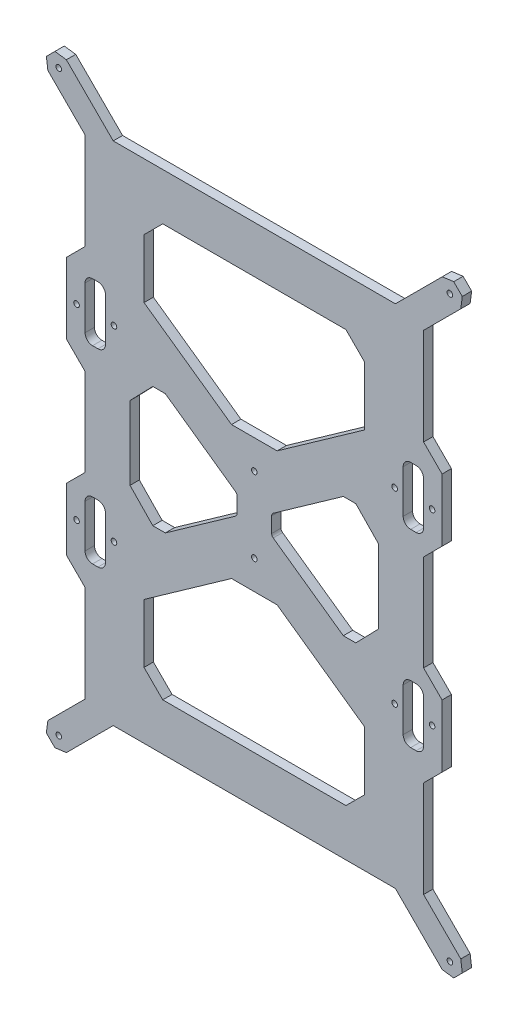
from build123d import *

# Parameters (mm, degrees)
SCHIZZO1_R                   = 1.5
ESTRUSIONE_ESTRUSIONE1_DEPTH = 5


with BuildPart() as part:
    # Schizzo1 → Estrusione-Estrusione1 (new body)
    with BuildSketch(Plane.XY):
        Polygon((-111.130864092, 156.55753287), (-106.55753287, 161.130864092), (-100.431262317, 160.330757253), (-75.393295673, 135.29279061), (75.393295673, 135.29279061), (100.431262317, 160.330757253), (106.55753287, 161.130864092), (111.130864092, 156.55753287), (110.330757253, 150.431262317), (90.448609444, 130.549114507), (90.448609444, 78.874114811), (100.330757253, 68.991967001), (100.330757253, 35.563826068), (90.448609444, 25.681678258), (90.448609444, -25.681678258), (100.330757253, -35.563826068), (100.330757253, -68.991967001), (90.448609444, -78.874114811), (90.448609444, -130.549114507), (110.330757253, -150.431262317), (111.130864092, -156.55753287), (106.55753287, -161.130864092), (100.431262317, -160.330757253), (75.393295673, -135.29279061), (-75.393295673, -135.29279061), (-100.431262317, -160.330757253), (-106.55753287, -161.130864092), (-111.130864092, -156.55753287), (-110.330757253, -150.431262317), (-90.448609444, -130.549114507), (-90.448609444, -78.874114811), (-100.330757253, -68.991967001), (-100.330757253, -35.563826068), (-90.448609444, -25.681678258), (-90.448609444, 21.125885189), (-100.330757253, 31.008032999), (-100.330757253, 68.991967001), (-90.448609444, 78.874114811), (-90.448609444, 130.549114507), (-110.330757253, 150.431262317), align=None)
        with Locations((-95, 50)):
            Circle(SCHIZZO1_R, mode=Mode.SUBTRACT)
        with Locations((-75, 50)):
            Circle(SCHIZZO1_R, mode=Mode.SUBTRACT)
        with Locations((-104.5, 154.5)):
            Circle(SCHIZZO1_R, mode=Mode.SUBTRACT)
        with Locations((104.5, 154.5)):
            Circle(SCHIZZO1_R, mode=Mode.SUBTRACT)
        with Locations((75, 50)):
            Circle(SCHIZZO1_R, mode=Mode.SUBTRACT)
        with Locations((95, 50)):
            Circle(SCHIZZO1_R, mode=Mode.SUBTRACT)
        with Locations((0, 20.131279802)):
            Circle(SCHIZZO1_R, mode=Mode.SUBTRACT)
        with Locations((0, -20.131279802)):
            Circle(SCHIZZO1_R, mode=Mode.SUBTRACT)
        with Locations((95, -50)):
            Circle(SCHIZZO1_R, mode=Mode.SUBTRACT)
        with Locations((75, -50)):
            Circle(SCHIZZO1_R, mode=Mode.SUBTRACT)
        with Locations((104.5, -154.5)):
            Circle(SCHIZZO1_R, mode=Mode.SUBTRACT)
        with Locations((-104.5, -154.5)):
            Circle(SCHIZZO1_R, mode=Mode.SUBTRACT)
        with Locations((-75, -50)):
            Circle(SCHIZZO1_R, mode=Mode.SUBTRACT)
        with Locations((-95, -50)):
            Circle(SCHIZZO1_R, mode=Mode.SUBTRACT)
        with BuildLine():
            Line((-66.435665908, 19.62934529), (-66.435665908, -19.62934529))
            Line((-66.435665908, -19.62934529), (-54.243131725, -32.22180516))
            Line((-54.243131725, -32.22180516), (-47.563810674, -32.22180516))
            Line((-47.563810674, -32.22180516), (-10.101900389, -5.729003291))
            ThreePointArc((-10.101900389, -5.729003291), (-9.48052072, -5.015427148), (-9.256694819, -4.096076524))
            Line((-9.256694819, -4.096076524), (-9.256694819, 4.096076524))
            ThreePointArc((-9.256694819, 4.096076524), (-9.48052072, 5.015427148), (-10.101900389, 5.729003291))
            Line((-10.101900389, 5.729003291), (-47.563810674, 32.22180516))
            Line((-47.563810674, 32.22180516), (-54.243131725, 32.22180516))
            Line((-54.243131725, 32.22180516), (-66.435665908, 19.62934529))
        make_face(mode=Mode.SUBTRACT)
        Polygon((-58.942185062, 100.139969228), (-58.942185062, 68.700211283), (-12.181822312, 35.631608635), (12.181822312, 35.631608635), (58.942185062, 68.700211283), (58.942185062, 100.139969228), (48.942185062, 110.139969228), (-48.942185062, 110.139969228), align=None, mode=Mode.SUBTRACT)
        with BuildLine():
            Line((-86.448609444, 35.007036896), (-83.551390556, 35.007036896))
            ThreePointArc((-83.551390556, 35.007036896), (-80.722963432, 36.178609771), (-79.551390556, 39.007036896))
            Line((-79.551390556, 39.007036896), (-79.551390556, 62.007036896))
            ThreePointArc((-79.551390556, 62.007036896), (-80.722963432, 64.835464021), (-83.551390556, 66.007036896))
            Line((-83.551390556, 66.007036896), (-86.448609444, 66.007036896))
            ThreePointArc((-86.448609444, 66.007036896), (-89.277036568, 64.835464021), (-90.448609444, 62.007036896))
            Line((-90.448609444, 62.007036896), (-90.448609444, 39.007036896))
            ThreePointArc((-90.448609444, 39.007036896), (-89.277036568, 36.178609771), (-86.448609444, 35.007036896))
        make_face(mode=Mode.SUBTRACT)
        with BuildLine():
            Line((86.448609444, 66.007036896), (83.551390556, 66.007036896))
            ThreePointArc((83.551390556, 66.007036896), (80.722963432, 64.835464021), (79.551390556, 62.007036896))
            Line((79.551390556, 62.007036896), (79.551390556, 39.007036896))
            ThreePointArc((79.551390556, 39.007036896), (80.722963432, 36.178609771), (83.551390556, 35.007036896))
            Line((83.551390556, 35.007036896), (86.448609444, 35.007036896))
            ThreePointArc((86.448609444, 35.007036896), (89.277036568, 36.178609771), (90.448609444, 39.007036896))
            Line((90.448609444, 39.007036896), (90.448609444, 62.007036896))
            ThreePointArc((90.448609444, 62.007036896), (89.277036568, 64.835464021), (86.448609444, 66.007036896))
        make_face(mode=Mode.SUBTRACT)
        with BuildLine():
            Line((47.563810674, 32.22180516), (10.101900389, 5.729003291))
            ThreePointArc((10.101900389, 5.729003291), (9.48052072, 5.015427148), (9.256694819, 4.096076524))
            Line((9.256694819, 4.096076524), (9.256694819, -4.096076524))
            ThreePointArc((9.256694819, -4.096076524), (9.48052072, -5.015427148), (10.101900389, -5.729003291))
            Line((10.101900389, -5.729003291), (47.563810674, -32.22180516))
            Line((47.563810674, -32.22180516), (54.243131725, -32.22180516))
            Line((54.243131725, -32.22180516), (66.435665908, -19.62934529))
            Line((66.435665908, -19.62934529), (66.435665908, 19.62934529))
            Line((66.435665908, 19.62934529), (54.243131725, 32.22180516))
            Line((54.243131725, 32.22180516), (47.563810674, 32.22180516))
        make_face(mode=Mode.SUBTRACT)
        with BuildLine():
            Line((-86.448609444, -66.007036896), (-83.551390556, -66.007036896))
            ThreePointArc((-83.551390556, -66.007036896), (-80.722963432, -64.835464021), (-79.551390556, -62.007036896))
            Line((-79.551390556, -62.007036896), (-79.551390556, -39.007036896))
            ThreePointArc((-79.551390556, -39.007036896), (-80.722963432, -36.178609771), (-83.551390556, -35.007036896))
            Line((-83.551390556, -35.007036896), (-86.448609444, -35.007036896))
            ThreePointArc((-86.448609444, -35.007036896), (-89.277036568, -36.178609771), (-90.448609444, -39.007036896))
            Line((-90.448609444, -39.007036896), (-90.448609444, -62.007036896))
            ThreePointArc((-90.448609444, -62.007036896), (-89.277036568, -64.835464021), (-86.448609444, -66.007036896))
        make_face(mode=Mode.SUBTRACT)
        Polygon((-48.942185062, -110.139969228), (48.942185062, -110.139969228), (58.942185062, -100.139969228), (58.942185062, -68.700211283), (12.181822312, -35.631608635), (-12.181822312, -35.631608635), (-58.942185062, -68.700211283), (-58.942185062, -100.139969228), align=None, mode=Mode.SUBTRACT)
        with BuildLine():
            Line((86.448609444, -35.007036896), (83.551390556, -35.007036896))
            ThreePointArc((83.551390556, -35.007036896), (80.722963432, -36.178609771), (79.551390556, -39.007036896))
            Line((79.551390556, -39.007036896), (79.551390556, -62.007036896))
            ThreePointArc((79.551390556, -62.007036896), (80.722963432, -64.835464021), (83.551390556, -66.007036896))
            Line((83.551390556, -66.007036896), (86.448609444, -66.007036896))
            ThreePointArc((86.448609444, -66.007036896), (89.277036568, -64.835464021), (90.448609444, -62.007036896))
            Line((90.448609444, -62.007036896), (90.448609444, -39.007036896))
            ThreePointArc((90.448609444, -39.007036896), (89.277036568, -36.178609771), (86.448609444, -35.007036896))
        make_face(mode=Mode.SUBTRACT)
    extrude(amount=-ESTRUSIONE_ESTRUSIONE1_DEPTH)


solid = part.part
